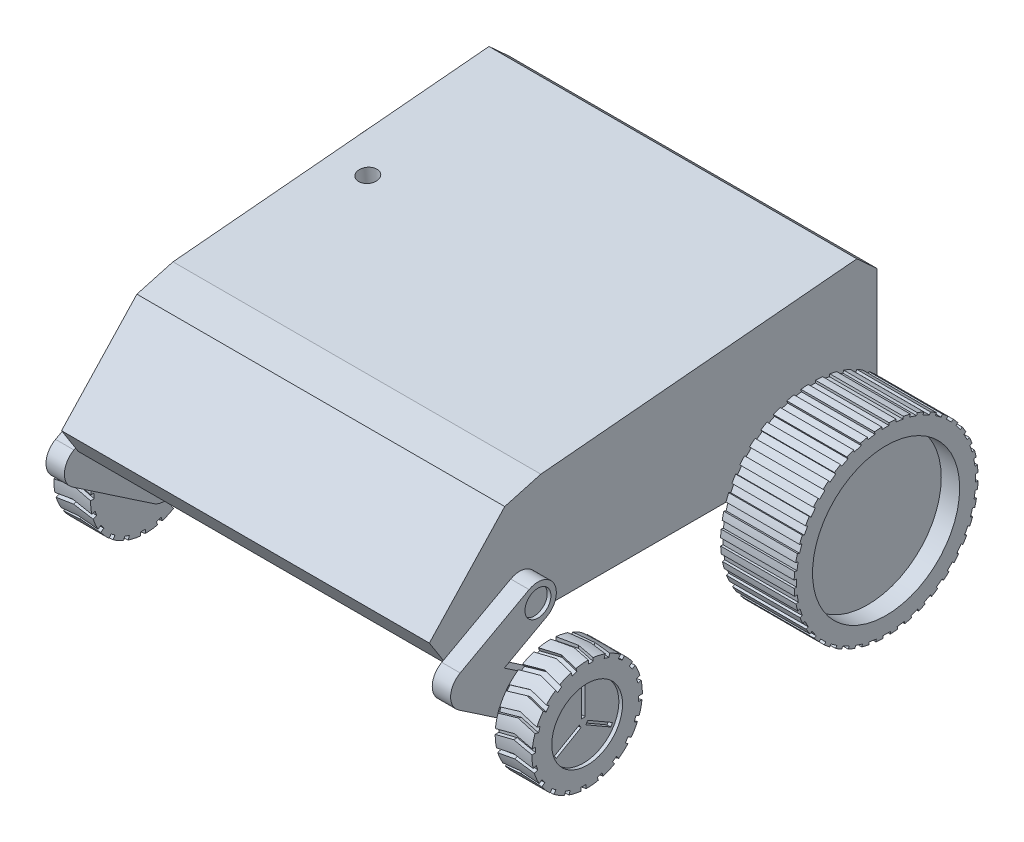
from build123d import *

# Parameters (mm, degrees)
BOSS_EXTRUDE1_DEPTH      = 100
BOSS_EXTRUDE2_DEPTH      = 10
SKETCH4_R                = 7.060387897
CUT_EXTRUDE1_DEPTH       = 2
SKETCH5_R                = 30
BOSS_EXTRUDE3_DEPTH      = 20
SKETCH6_R                = 19.251746144
CUT_EXTRUDE2_DEPTH       = 2
SKETCH7_W                = 1.908440734
SKETCH7_H                = 15.565707942
CUT_EXTRUDE3_DEPTH       = 2
CIRPATTERN1_COUNT        = 3
CUT_EXTRUDE4_DEPTH       = 2
CIRPATTERN2_COUNT        = 20
SKETCH9_R                = 50
BOSS_EXTRUDE4_DEPTH      = 40
SKETCH10_R               = 40
CUT_EXTRUDE6_DEPTH       = 10
SKETCH11_W               = 1.964862178
SKETCH11_H               = 3.929724355
CUT_EXTRUDE7_DEPTH       = 40
CIRPATTERN3_COUNT        = 40
MIRROR1_COPY_1_SKETCH_W  = 1.908440734
MIRROR1_COPY_1_SKETCH_H  = 15.565707942
MIRROR1_COPY_1_DEPTH     = 2
MIRROR1_COPY_2_SKETCH_W  = 1.908440734
MIRROR1_COPY_2_SKETCH_H  = 15.565707942
MIRROR1_COPY_2_DEPTH     = 2
MIRROR1_COPY_3_SKETCH_W  = 1.908440734
MIRROR1_COPY_3_SKETCH_H  = 15.565707942
MIRROR1_COPY_3_DEPTH     = 2
MIRROR1_COPY_4_DEPTH     = 2
MIRROR1_COPY_5_DEPTH     = 2
MIRROR1_COPY_6_DEPTH     = 2
MIRROR1_COPY_7_DEPTH     = 2
MIRROR1_COPY_8_DEPTH     = 2
MIRROR1_COPY_9_DEPTH     = 2
MIRROR1_COPY_10_DEPTH    = 2
MIRROR1_COPY_11_DEPTH    = 2
MIRROR1_COPY_12_DEPTH    = 2
MIRROR1_COPY_13_DEPTH    = 2
MIRROR1_COPY_14_DEPTH    = 2
MIRROR1_COPY_15_DEPTH    = 2
MIRROR1_COPY_16_DEPTH    = 2
MIRROR1_COPY_17_DEPTH    = 2
MIRROR1_COPY_18_DEPTH    = 2
MIRROR1_COPY_19_DEPTH    = 2
MIRROR1_COPY_20_DEPTH    = 2
MIRROR1_COPY_21_DEPTH    = 2
MIRROR1_COPY_22_DEPTH    = 2
MIRROR1_COPY_23_DEPTH    = 2
MIRROR1_COPY_24_SKETCH_W = 1.964862178
MIRROR1_COPY_24_SKETCH_H = 3.929724355
MIRROR1_COPY_24_DEPTH    = 40
MIRROR1_COPY_25_SKETCH_W = 1.964862178
MIRROR1_COPY_25_SKETCH_H = 3.929724355
MIRROR1_COPY_25_DEPTH    = 40
MIRROR1_COPY_26_SKETCH_W = 1.964862178
MIRROR1_COPY_26_SKETCH_H = 3.929724355
MIRROR1_COPY_26_DEPTH    = 40
MIRROR1_COPY_27_SKETCH_W = 1.964862178
MIRROR1_COPY_27_SKETCH_H = 3.929724355
MIRROR1_COPY_27_DEPTH    = 40
MIRROR1_COPY_28_SKETCH_W = 1.964862178
MIRROR1_COPY_28_SKETCH_H = 3.929724355
MIRROR1_COPY_28_DEPTH    = 40
MIRROR1_COPY_29_SKETCH_W = 1.964862178
MIRROR1_COPY_29_SKETCH_H = 3.929724355
MIRROR1_COPY_29_DEPTH    = 40
MIRROR1_COPY_30_SKETCH_W = 1.964862178
MIRROR1_COPY_30_SKETCH_H = 3.929724355
MIRROR1_COPY_30_DEPTH    = 40
MIRROR1_COPY_31_SKETCH_W = 1.964862178
MIRROR1_COPY_31_SKETCH_H = 3.929724355
MIRROR1_COPY_31_DEPTH    = 40
MIRROR1_COPY_32_SKETCH_W = 1.964862178
MIRROR1_COPY_32_SKETCH_H = 3.929724355
MIRROR1_COPY_32_DEPTH    = 40
MIRROR1_COPY_33_SKETCH_W = 1.964862178
MIRROR1_COPY_33_SKETCH_H = 3.929724355
MIRROR1_COPY_33_DEPTH    = 40
MIRROR1_COPY_34_SKETCH_W = 1.964862178
MIRROR1_COPY_34_SKETCH_H = 3.929724355
MIRROR1_COPY_34_DEPTH    = 40
MIRROR1_COPY_35_SKETCH_W = 1.964862178
MIRROR1_COPY_35_SKETCH_H = 3.929724355
MIRROR1_COPY_35_DEPTH    = 40
MIRROR1_COPY_36_SKETCH_W = 1.964862178
MIRROR1_COPY_36_SKETCH_H = 3.929724355
MIRROR1_COPY_36_DEPTH    = 40
MIRROR1_COPY_37_SKETCH_W = 1.964862178
MIRROR1_COPY_37_SKETCH_H = 3.929724355
MIRROR1_COPY_37_DEPTH    = 40
MIRROR1_COPY_38_SKETCH_W = 1.964862178
MIRROR1_COPY_38_SKETCH_H = 3.929724355
MIRROR1_COPY_38_DEPTH    = 40
MIRROR1_COPY_39_SKETCH_W = 1.964862178
MIRROR1_COPY_39_SKETCH_H = 3.929724355
MIRROR1_COPY_39_DEPTH    = 40
MIRROR1_COPY_40_SKETCH_W = 1.964862178
MIRROR1_COPY_40_SKETCH_H = 3.929724355
MIRROR1_COPY_40_DEPTH    = 40
MIRROR1_COPY_41_SKETCH_W = 1.964862178
MIRROR1_COPY_41_SKETCH_H = 3.929724355
MIRROR1_COPY_41_DEPTH    = 40
MIRROR1_COPY_42_SKETCH_W = 1.964862178
MIRROR1_COPY_42_SKETCH_H = 3.929724355
MIRROR1_COPY_42_DEPTH    = 40
MIRROR1_COPY_43_SKETCH_W = 1.964862178
MIRROR1_COPY_43_SKETCH_H = 3.929724355
MIRROR1_COPY_43_DEPTH    = 40
MIRROR1_COPY_44_SKETCH_W = 1.964862178
MIRROR1_COPY_44_SKETCH_H = 3.929724355
MIRROR1_COPY_44_DEPTH    = 40
MIRROR1_COPY_45_SKETCH_W = 1.964862178
MIRROR1_COPY_45_SKETCH_H = 3.929724355
MIRROR1_COPY_45_DEPTH    = 40
MIRROR1_COPY_46_SKETCH_W = 1.964862178
MIRROR1_COPY_46_SKETCH_H = 3.929724355
MIRROR1_COPY_46_DEPTH    = 40
MIRROR1_COPY_47_SKETCH_W = 1.964862178
MIRROR1_COPY_47_SKETCH_H = 3.929724355
MIRROR1_COPY_47_DEPTH    = 40
MIRROR1_COPY_48_SKETCH_W = 1.964862178
MIRROR1_COPY_48_SKETCH_H = 3.929724355
MIRROR1_COPY_48_DEPTH    = 40
MIRROR1_COPY_49_SKETCH_W = 1.964862178
MIRROR1_COPY_49_SKETCH_H = 3.929724355
MIRROR1_COPY_49_DEPTH    = 40
MIRROR1_COPY_50_SKETCH_W = 1.964862178
MIRROR1_COPY_50_SKETCH_H = 3.929724355
MIRROR1_COPY_50_DEPTH    = 40
MIRROR1_COPY_51_SKETCH_W = 1.964862178
MIRROR1_COPY_51_SKETCH_H = 3.929724355
MIRROR1_COPY_51_DEPTH    = 40
MIRROR1_COPY_52_SKETCH_W = 1.964862178
MIRROR1_COPY_52_SKETCH_H = 3.929724355
MIRROR1_COPY_52_DEPTH    = 40
MIRROR1_COPY_53_SKETCH_W = 1.964862178
MIRROR1_COPY_53_SKETCH_H = 3.929724355
MIRROR1_COPY_53_DEPTH    = 40
MIRROR1_COPY_54_SKETCH_W = 1.964862178
MIRROR1_COPY_54_SKETCH_H = 3.929724355
MIRROR1_COPY_54_DEPTH    = 40
MIRROR1_COPY_55_SKETCH_W = 1.964862178
MIRROR1_COPY_55_SKETCH_H = 3.929724355
MIRROR1_COPY_55_DEPTH    = 40
MIRROR1_COPY_56_SKETCH_W = 1.964862178
MIRROR1_COPY_56_SKETCH_H = 3.929724355
MIRROR1_COPY_56_DEPTH    = 40
MIRROR1_COPY_57_SKETCH_W = 1.964862178
MIRROR1_COPY_57_SKETCH_H = 3.929724355
MIRROR1_COPY_57_DEPTH    = 40
MIRROR1_COPY_58_SKETCH_W = 1.964862178
MIRROR1_COPY_58_SKETCH_H = 3.929724355
MIRROR1_COPY_58_DEPTH    = 40
MIRROR1_COPY_59_SKETCH_W = 1.964862178
MIRROR1_COPY_59_SKETCH_H = 3.929724355
MIRROR1_COPY_59_DEPTH    = 40
MIRROR1_COPY_60_SKETCH_W = 1.964862178
MIRROR1_COPY_60_SKETCH_H = 3.929724355
MIRROR1_COPY_60_DEPTH    = 40
MIRROR1_COPY_61_SKETCH_W = 1.964862178
MIRROR1_COPY_61_SKETCH_H = 3.929724355
MIRROR1_COPY_61_DEPTH    = 40
MIRROR1_COPY_62_SKETCH_W = 1.964862178
MIRROR1_COPY_62_SKETCH_H = 3.929724355
MIRROR1_COPY_62_DEPTH    = 40
MIRROR1_COPY_63_SKETCH_W = 1.964862178
MIRROR1_COPY_63_SKETCH_H = 3.929724355
MIRROR1_COPY_63_DEPTH    = 40
SKETCH12_R               = 5
CUT_EXTRUDE8_DEPTH       = 10


with BuildPart() as part:
    # Sketch2 → Boss-Extrude1 (new, symmetric)
    with BuildSketch(Plane(origin=(0, 0, 0), x_dir=(0, 0, -1), z_dir=(1, 0, 0))):
        Polygon((-52.068712601, 63.521766104), (-71.699835093, 58.096578332), (-112.67312909, 14.303868284), (-103.595649647, 0), (120.646817248, 0), (130.646817248, 10), (130.646817248, 69.057563665), (119.748610721, 79.017143226), align=None)
    extrude(amount=BOSS_EXTRUDE1_DEPTH, both=True)

    # Sketch3 → Boss-Extrude2 (add)
    with BuildSketch(Plane(origin=(100, 0, 0), x_dir=(0, 0, -1), z_dir=(1, 0, 0))):
        with BuildLine():
            Line((-106.727157144, -15.2070753), (-62.498185944, -45.147816854))
            ThreePointArc((-62.498185944, -45.147816854), (-48.61138022, -42.472629612), (-51.286567461, -28.585823888))
            Line((-51.286567461, -28.585823888), (-81.94732065, -7.830068957))
            Line((-81.94732065, -7.830068957), (-58.843844634, 4.817340342))
            ThreePointArc((-58.843844634, 4.817340342), (-54.873996715, 18.390855271), (-68.447511643, 22.360703189))
            Line((-68.447511643, 22.360703189), (-105.923181407, 1.845602606))
            ThreePointArc((-105.923181407, 1.845602606), (-111.110252388, -6.45513596), (-106.727157144, -15.2070753))
        make_face()
    boss_extrude2 = extrude(amount=BOSS_EXTRUDE2_DEPTH)

    # Sketch4 → Cut-Extrude1 (cut)
    with BuildSketch(Plane(origin=(110, 0, 0), x_dir=(0, 0, -1), z_dir=(1, 0, 0))):
        with Locations((-63.645678139, 13.589021766)):
            Circle(SKETCH4_R)
    extrude(amount=-CUT_EXTRUDE1_DEPTH, mode=Mode.SUBTRACT)

    # Sketch5 → Boss-Extrude3 (add)
    with BuildSketch(Plane(origin=(110, 0, 0), x_dir=(0, 0, -1), z_dir=(1, 0, 0))):
        with Locations((-56.892376703, -36.866820371)):
            Circle(SKETCH5_R)
    boss_extrude3 = extrude(amount=BOSS_EXTRUDE3_DEPTH)

    # Sketch6 → Cut-Extrude2 (cut)
    with BuildSketch(Plane(origin=(130, 0, 0), x_dir=(0, 0, -1), z_dir=(1, 0, 0))):
        with Locations((-56.892376703, -36.866820371)):
            Circle(SKETCH6_R)
    cut_extrude2 = extrude(amount=-CUT_EXTRUDE2_DEPTH, mode=Mode.SUBTRACT)

    # Sketch7 → Cut-Extrude3 (cut)
    with BuildSketch(Plane(origin=(128, 0, 0), x_dir=(0, 0, -1), z_dir=(1, 0, 0))):
        with Locations((-56.892376703, -26.98617405)):
            Rectangle(SKETCH7_W, SKETCH7_H)
    cut_extrude3 = extrude(amount=-CUT_EXTRUDE3_DEPTH, mode=Mode.SUBTRACT)

    # CirPattern1: Cut-Extrude3 ×3 about axis
    cirpattern1_axis = Axis((128, -36.866820371, 56.892376703), (1, 0, 0))
    for i in range(1, CIRPATTERN1_COUNT):
        add(cut_extrude3.rotate(cirpattern1_axis, i * 360 / CIRPATTERN1_COUNT), mode=Mode.SUBTRACT)

    # Sketch8 → Cut-Extrude4 (cut)
    with BuildSketch(Plane(origin=(0, 0, 26.892376703), x_dir=(-1, 0, 0), z_dir=(0, 0, -1))):
        Polygon((-119.962011175, -39.569901117), (-109.069375128, -36.90013738), (-109.069375128, -39.569901117), (-119.962011175, -42.239664854), (-132.776877113, -39.569901117), (-132.776877113, -36.90013738), align=None)
    cut_extrude4 = extrude(amount=-CUT_EXTRUDE4_DEPTH, mode=Mode.SUBTRACT)

    # CirPattern2: Cut-Extrude4 ×20 about axis
    cirpattern2_axis = Axis((130, -36.866820371, 56.892376703), (1, 0, 0))
    for i in range(1, CIRPATTERN2_COUNT):
        add(cut_extrude4.rotate(cirpattern2_axis, i * 360 / CIRPATTERN2_COUNT), mode=Mode.SUBTRACT)

    # Sketch9 → Boss-Extrude4 (add)
    with BuildSketch(Plane(origin=(100, 0, 0), x_dir=(0, 0, -1), z_dir=(1, 0, 0))):
        with Locations((95.646817248, -16.866820371)):
            Circle(SKETCH9_R)
    boss_extrude4 = extrude(amount=BOSS_EXTRUDE4_DEPTH)

    # Sketch10 → Cut-Extrude6 (cut)
    with BuildSketch(Plane(origin=(140, 0, 0), x_dir=(0, 0, -1), z_dir=(1, 0, 0))):
        with Locations((95.646817248, -16.866820371)):
            Circle(SKETCH10_R)
    cut_extrude6 = extrude(amount=-CUT_EXTRUDE6_DEPTH, mode=Mode.SUBTRACT)

    # Sketch11 → Cut-Extrude7 (cut)
    with BuildSketch(Plane(origin=(140, 0, 0), x_dir=(0, 0, -1), z_dir=(1, 0, 0))):
        with Locations((145.317904313, -16.495970473)):
            Rectangle(SKETCH11_W, SKETCH11_H)
    cut_extrude7 = extrude(amount=-CUT_EXTRUDE7_DEPTH, mode=Mode.SUBTRACT)

    # CirPattern3: Cut-Extrude7 ×40 about axis
    cirpattern3_axis = Axis((140, -16.866820371, -95.646817248), (1, 0, 0))
    for i in range(1, CIRPATTERN3_COUNT):
        add(cut_extrude7.rotate(cirpattern3_axis, i * 360 / CIRPATTERN3_COUNT), mode=Mode.SUBTRACT)

    # Mirror1: Boss-Extrude2, Boss-Extrude3, Cut-Extrude2, Boss-Extrude4, Cut-Extrude6 across plane
    add(boss_extrude2.mirror(Plane(origin=(0, 0, 0), x_dir=(0, 0, 1), z_dir=(1, 0, 0))))
    add(boss_extrude3.mirror(Plane(origin=(0, 0, 0), x_dir=(0, 0, 1), z_dir=(1, 0, 0))))
    add(cut_extrude2.mirror(Plane(origin=(0, 0, 0), x_dir=(0, 0, 1), z_dir=(1, 0, 0))), mode=Mode.SUBTRACT)
    add(boss_extrude4.mirror(Plane(origin=(0, 0, 0), x_dir=(0, 0, 1), z_dir=(1, 0, 0))))
    add(cut_extrude6.mirror(Plane(origin=(0, 0, 0), x_dir=(0, 0, 1), z_dir=(1, 0, 0))), mode=Mode.SUBTRACT)

    # Mirror1 copy 1 sketch → Mirror1 copy 1 (cut)
    with BuildSketch(Plane(origin=(-128, -6.02998705, 117.266168052), x_dir=(0, 0.8660254037844387, 0.4999999999999998), z_dir=(-1, 0, 0))):
        with Locations((-56.892376703, 26.98617405)):
            Rectangle(MIRROR1_COPY_1_SKETCH_W, MIRROR1_COPY_1_SKETCH_H)
    extrude(amount=-MIRROR1_COPY_1_DEPTH, mode=Mode.SUBTRACT)

    # Mirror1 copy 2 sketch → Mirror1 copy 2 (cut)
    with BuildSketch(Plane(origin=(-128, -104.570474062, 53.410962056), x_dir=(0, -0.8660254037844384, 0.5000000000000004), z_dir=(-1, 0, 0))):
        with Locations((-56.892376703, 26.98617405)):
            Rectangle(MIRROR1_COPY_2_SKETCH_W, MIRROR1_COPY_2_SKETCH_H)
    extrude(amount=-MIRROR1_COPY_2_DEPTH, mode=Mode.SUBTRACT)

    # Mirror1 copy 3 sketch → Mirror1 copy 3 (cut)
    with BuildSketch(Plane(origin=(-128, 0, 0), x_dir=(0, 0, -1), z_dir=(-1, 0, 0))):
        with Locations((-56.892376703, 26.98617405)):
            Rectangle(MIRROR1_COPY_3_SKETCH_W, MIRROR1_COPY_3_SKETCH_H)
    extrude(amount=-MIRROR1_COPY_3_DEPTH, mode=Mode.SUBTRACT)

    # Mirror1 copy 4 sketch → Mirror1 copy 4 (cut)
    with BuildSketch(Plane(origin=(0, 7.466119209, 39.753155237), x_dir=(1, 0, 0), z_dir=(0, 0.3090169943749474, -0.9510565162951535))):
        Polygon((-119.962011175, 39.569901117), (-109.069375128, 36.90013738), (-109.069375128, 39.569901117), (-119.962011175, 42.239664854), (-132.776877113, 39.569901117), (-132.776877113, 36.90013738), align=None)
    extrude(amount=-MIRROR1_COPY_4_DEPTH, mode=Mode.SUBTRACT)

    # Mirror1 copy 5 sketch → Mirror1 copy 5 (cut)
    with BuildSketch(Plane(origin=(0, 10.592621407, 54.291640184), x_dir=(1, 0, 0), z_dir=(0, 0.5877852522924731, -0.8090169943749475))):
        Polygon((-119.962011175, 39.569901117), (-109.069375128, 36.90013738), (-109.069375128, 39.569901117), (-119.962011175, 42.239664854), (-132.776877113, 39.569901117), (-132.776877113, 36.90013738), align=None)
    extrude(amount=-MIRROR1_COPY_5_DEPTH, mode=Mode.SUBTRACT)

    # Mirror1 copy 6 sketch → Mirror1 copy 6 (cut)
    with BuildSketch(Plane(origin=(0, 9.073462773, 69.084703343), x_dir=(1, 0, 0), z_dir=(0, 0.8090169943749475, -0.5877852522924731))):
        Polygon((-119.962011175, 39.569901117), (-109.069375128, 36.90013738), (-109.069375128, 39.569901117), (-119.962011175, 42.239664854), (-132.776877113, 39.569901117), (-132.776877113, 36.90013738), align=None)
    extrude(amount=-MIRROR1_COPY_6_DEPTH, mode=Mode.SUBTRACT)

    # Mirror1 copy 7 sketch → Mirror1 copy 7 (cut)
    with BuildSketch(Plane(origin=(0, 3.057349141, 82.68429662), x_dir=(1, 0, 0), z_dir=(0, 0.9510565162951535, -0.30901699437494745))):
        Polygon((-119.962011175, 39.569901117), (-109.069375128, 36.90013738), (-109.069375128, 39.569901117), (-119.962011175, 42.239664854), (-132.776877113, 39.569901117), (-132.776877113, 36.90013738), align=None)
    extrude(amount=-MIRROR1_COPY_7_DEPTH, mode=Mode.SUBTRACT)

    # Mirror1 copy 8 sketch → Mirror1 copy 8 (cut)
    with BuildSketch(Plane(origin=(0, -6.866820371, 93.759197074), x_dir=(1, 0, 0), z_dir=(0, 1, 0))):
        Polygon((-119.962011175, 39.569901117), (-109.069375128, 36.90013738), (-109.069375128, 39.569901117), (-119.962011175, 42.239664854), (-132.776877113, 39.569901117), (-132.776877113, 36.90013738), align=None)
    extrude(amount=-MIRROR1_COPY_8_DEPTH, mode=Mode.SUBTRACT)

    # Mirror1 copy 9 sketch → Mirror1 copy 9 (cut)
    with BuildSketch(Plane(origin=(0, -19.727598905, 101.225316283), x_dir=(1, 0, 0), z_dir=(0, 0.9510565162951536, 0.30901699437494734))):
        Polygon((-119.962011175, 39.569901117), (-109.069375128, 36.90013738), (-109.069375128, 39.569901117), (-119.962011175, 42.239664854), (-132.776877113, 39.569901117), (-132.776877113, 36.90013738), align=None)
    extrude(amount=-MIRROR1_COPY_9_DEPTH, mode=Mode.SUBTRACT)

    # Mirror1 copy 10 sketch → Mirror1 copy 10 (cut)
    with BuildSketch(Plane(origin=(0, -34.266083852, 104.35181848), x_dir=(1, 0, 0), z_dir=(0, 0.8090169943749475, 0.587785252292473))):
        Polygon((-119.962011175, 39.569901117), (-109.069375128, 36.90013738), (-109.069375128, 39.569901117), (-119.962011175, 42.239664854), (-132.776877113, 39.569901117), (-132.776877113, 36.90013738), align=None)
    extrude(amount=-MIRROR1_COPY_10_DEPTH, mode=Mode.SUBTRACT)

    # Mirror1 copy 11 sketch → Mirror1 copy 11 (cut)
    with BuildSketch(Plane(origin=(0, -49.059147011, 102.832659847), x_dir=(1, 0, 0), z_dir=(0, 0.5877852522924732, 0.8090169943749473))):
        Polygon((-119.962011175, 39.569901117), (-109.069375128, 36.90013738), (-109.069375128, 39.569901117), (-119.962011175, 42.239664854), (-132.776877113, 39.569901117), (-132.776877113, 36.90013738), align=None)
    extrude(amount=-MIRROR1_COPY_11_DEPTH, mode=Mode.SUBTRACT)

    # Mirror1 copy 12 sketch → Mirror1 copy 12 (cut)
    with BuildSketch(Plane(origin=(0, -62.658740288, 96.816546215), x_dir=(1, 0, 0), z_dir=(0, 0.3090169943749475, 0.9510565162951535))):
        Polygon((-119.962011175, 39.569901117), (-109.069375128, 36.90013738), (-109.069375128, 39.569901117), (-119.962011175, 42.239664854), (-132.776877113, 39.569901117), (-132.776877113, 36.90013738), align=None)
    extrude(amount=-MIRROR1_COPY_12_DEPTH, mode=Mode.SUBTRACT)

    # Mirror1 copy 13 sketch → Mirror1 copy 13 (cut)
    with BuildSketch(Plane(origin=(0, -73.733640742, 86.892376703), x_dir=(1, 0, 0), z_dir=(0, 0, 1))):
        Polygon((-119.962011175, 39.569901117), (-109.069375128, 36.90013738), (-109.069375128, 39.569901117), (-119.962011175, 42.239664854), (-132.776877113, 39.569901117), (-132.776877113, 36.90013738), align=None)
    extrude(amount=-MIRROR1_COPY_13_DEPTH, mode=Mode.SUBTRACT)

    # Mirror1 copy 14 sketch → Mirror1 copy 14 (cut)
    with BuildSketch(Plane(origin=(0, -81.199759951, 74.031598168), x_dir=(1, 0, 0), z_dir=(0, -0.3090169943749473, 0.9510565162951536))):
        Polygon((-119.962011175, 39.569901117), (-109.069375128, 36.90013738), (-109.069375128, 39.569901117), (-119.962011175, 42.239664854), (-132.776877113, 39.569901117), (-132.776877113, 36.90013738), align=None)
    extrude(amount=-MIRROR1_COPY_14_DEPTH, mode=Mode.SUBTRACT)

    # Mirror1 copy 15 sketch → Mirror1 copy 15 (cut)
    with BuildSketch(Plane(origin=(0, -84.326262148, 59.493113221), x_dir=(1, 0, 0), z_dir=(0, -0.587785252292473, 0.8090169943749476))):
        Polygon((-119.962011175, 39.569901117), (-109.069375128, 36.90013738), (-109.069375128, 39.569901117), (-119.962011175, 42.239664854), (-132.776877113, 39.569901117), (-132.776877113, 36.90013738), align=None)
    extrude(amount=-MIRROR1_COPY_15_DEPTH, mode=Mode.SUBTRACT)

    # Mirror1 copy 16 sketch → Mirror1 copy 16 (cut)
    with BuildSketch(Plane(origin=(0, -82.807103515, 44.700050063), x_dir=(1, 0, 0), z_dir=(0, -0.8090169943749473, 0.5877852522924732))):
        Polygon((-119.962011175, 39.569901117), (-109.069375128, 36.90013738), (-109.069375128, 39.569901117), (-119.962011175, 42.239664854), (-132.776877113, 39.569901117), (-132.776877113, 36.90013738), align=None)
    extrude(amount=-MIRROR1_COPY_16_DEPTH, mode=Mode.SUBTRACT)

    # Mirror1 copy 17 sketch → Mirror1 copy 17 (cut)
    with BuildSketch(Plane(origin=(0, -76.790989883, 31.100456785), x_dir=(1, 0, 0), z_dir=(0, -0.9510565162951535, 0.30901699437494756))):
        Polygon((-119.962011175, 39.569901117), (-109.069375128, 36.90013738), (-109.069375128, 39.569901117), (-119.962011175, 42.239664854), (-132.776877113, 39.569901117), (-132.776877113, 36.90013738), align=None)
    extrude(amount=-MIRROR1_COPY_17_DEPTH, mode=Mode.SUBTRACT)

    # Mirror1 copy 18 sketch → Mirror1 copy 18 (cut)
    with BuildSketch(Plane(origin=(0, -66.866820371, 20.025556332), x_dir=(1, 0, 0), z_dir=(0, -1, 0))):
        Polygon((-119.962011175, 39.569901117), (-109.069375128, 36.90013738), (-109.069375128, 39.569901117), (-119.962011175, 42.239664854), (-132.776877113, 39.569901117), (-132.776877113, 36.90013738), align=None)
    extrude(amount=-MIRROR1_COPY_18_DEPTH, mode=Mode.SUBTRACT)

    # Mirror1 copy 19 sketch → Mirror1 copy 19 (cut)
    with BuildSketch(Plane(origin=(0, -54.006041837, 12.559437123), x_dir=(1, 0, 0), z_dir=(0, -0.9510565162951536, -0.30901699437494723))):
        Polygon((-119.962011175, 39.569901117), (-109.069375128, 36.90013738), (-109.069375128, 39.569901117), (-119.962011175, 42.239664854), (-132.776877113, 39.569901117), (-132.776877113, 36.90013738), align=None)
    extrude(amount=-MIRROR1_COPY_19_DEPTH, mode=Mode.SUBTRACT)

    # Mirror1 copy 20 sketch → Mirror1 copy 20 (cut)
    with BuildSketch(Plane(origin=(0, -39.467556889, 9.432934925), x_dir=(1, 0, 0), z_dir=(0, -0.8090169943749476, -0.5877852522924729))):
        Polygon((-119.962011175, 39.569901117), (-109.069375128, 36.90013738), (-109.069375128, 39.569901117), (-119.962011175, 42.239664854), (-132.776877113, 39.569901117), (-132.776877113, 36.90013738), align=None)
    extrude(amount=-MIRROR1_COPY_20_DEPTH, mode=Mode.SUBTRACT)

    # Mirror1 copy 21 sketch → Mirror1 copy 21 (cut)
    with BuildSketch(Plane(origin=(0, -24.674493731, 10.952093559), x_dir=(1, 0, 0), z_dir=(0, -0.5877852522924734, -0.8090169943749473))):
        Polygon((-119.962011175, 39.569901117), (-109.069375128, 36.90013738), (-109.069375128, 39.569901117), (-119.962011175, 42.239664854), (-132.776877113, 39.569901117), (-132.776877113, 36.90013738), align=None)
    extrude(amount=-MIRROR1_COPY_21_DEPTH, mode=Mode.SUBTRACT)

    # Mirror1 copy 22 sketch → Mirror1 copy 22 (cut)
    with BuildSketch(Plane(origin=(0, -11.074900453, 16.968207191), x_dir=(1, 0, 0), z_dir=(0, -0.3090169943749476, -0.9510565162951535))):
        Polygon((-119.962011175, 39.569901117), (-109.069375128, 36.90013738), (-109.069375128, 39.569901117), (-119.962011175, 42.239664854), (-132.776877113, 39.569901117), (-132.776877113, 36.90013738), align=None)
    extrude(amount=-MIRROR1_COPY_22_DEPTH, mode=Mode.SUBTRACT)

    # Mirror1 copy 23 sketch → Mirror1 copy 23 (cut)
    with BuildSketch(Plane(origin=(0, 0, 26.892376703), x_dir=(1, 0, 0), z_dir=(0, 0, -1))):
        Polygon((-119.962011175, 39.569901117), (-109.069375128, 36.90013738), (-109.069375128, 39.569901117), (-119.962011175, 42.239664854), (-132.776877113, 39.569901117), (-132.776877113, 36.90013738), align=None)
    extrude(amount=-MIRROR1_COPY_23_DEPTH, mode=Mode.SUBTRACT)

    # Mirror1 copy 24 sketch → Mirror1 copy 24 (cut)
    with BuildSketch(Plane(origin=(-140, -15.170117237, 1.460980985), x_dir=(0, 0.15643446504023087, -0.9876883405951378), z_dir=(-1, 0, 0))):
        with Locations((145.317904313, 16.495970473)):
            Rectangle(MIRROR1_COPY_24_SKETCH_W, MIRROR1_COPY_24_SKETCH_H)
    extrude(amount=-MIRROR1_COPY_24_DEPTH, mode=Mode.SUBTRACT)

    # Mirror1 copy 25 sketch → Mirror1 copy 25 (cut)
    with BuildSketch(Plane(origin=(-140, -30.382012936, 0.530845694), x_dir=(0, 0.3090169943749474, -0.9510565162951535), z_dir=(-1, 0, 0))):
        with Locations((145.317904313, 16.495970473)):
            Rectangle(MIRROR1_COPY_25_SKETCH_W, MIRROR1_COPY_25_SKETCH_H)
    extrude(amount=-MIRROR1_COPY_25_DEPTH, mode=Mode.SUBTRACT)

    # Mirror1 copy 26 sketch → Mirror1 copy 26 (cut)
    with BuildSketch(Plane(origin=(-140, -45.261119739, -2.767502853), x_dir=(0, 0.45399049973954675, -0.8910065241883679), z_dir=(-1, 0, 0))):
        with Locations((145.317904313, 16.495970473)):
            Rectangle(MIRROR1_COPY_26_SKETCH_W, MIRROR1_COPY_26_SKETCH_H)
    extrude(amount=-MIRROR1_COPY_26_DEPTH, mode=Mode.SUBTRACT)

    # Mirror1 copy 27 sketch → Mirror1 copy 27 (cut)
    with BuildSketch(Plane(origin=(-140, -59.441064657, -8.35284837), x_dir=(0, 0.5877852522924731, -0.8090169943749475), z_dir=(-1, 0, 0))):
        with Locations((145.317904313, 16.495970473)):
            Rectangle(MIRROR1_COPY_27_SKETCH_W, MIRROR1_COPY_27_SKETCH_H)
    extrude(amount=-MIRROR1_COPY_27_DEPTH, mode=Mode.SUBTRACT)

    # Mirror1 copy 28 sketch → Mirror1 copy 28 (cut)
    with BuildSketch(Plane(origin=(-140, -72.572690385, -16.087661112), x_dir=(0, 0.7071067811865475, -0.7071067811865476), z_dir=(-1, 0, 0))):
        with Locations((145.317904313, 16.495970473)):
            Rectangle(MIRROR1_COPY_28_SKETCH_W, MIRROR1_COPY_28_SKETCH_H)
    extrude(amount=-MIRROR1_COPY_28_DEPTH, mode=Mode.SUBTRACT)

    # Mirror1 copy 29 sketch → Mirror1 copy 29 (cut)
    with BuildSketch(Plane(origin=(-140, -84.332652716, -25.78148432), x_dir=(0, 0.8090169943749475, -0.5877852522924731), z_dir=(-1, 0, 0))):
        with Locations((145.317904313, 16.495970473)):
            Rectangle(MIRROR1_COPY_29_SKETCH_W, MIRROR1_COPY_29_SKETCH_H)
    extrude(amount=-MIRROR1_COPY_29_DEPTH, mode=Mode.SUBTRACT)

    # Mirror1 copy 30 sketch → Mirror1 copy 30 (cut)
    with BuildSketch(Plane(origin=(-140, -94.431382348, -37.195623895), x_dir=(0, 0.8910065241883678, -0.4539904997395468), z_dir=(-1, 0, 0))):
        with Locations((145.317904313, 16.495970473)):
            Rectangle(MIRROR1_COPY_30_SKETCH_W, MIRROR1_COPY_30_SKETCH_H)
    extrude(amount=-MIRROR1_COPY_30_DEPTH, mode=Mode.SUBTRACT)

    # Mirror1 copy 31 sketch → Mirror1 copy 31 (cut)
    with BuildSketch(Plane(origin=(-140, -102.620215042, -50.049025838), x_dir=(0, 0.9510565162951535, -0.30901699437494745), z_dir=(-1, 0, 0))):
        with Locations((145.317904313, 16.495970473)):
            Rectangle(MIRROR1_COPY_31_SKETCH_W, MIRROR1_COPY_31_SKETCH_H)
    extrude(amount=-MIRROR1_COPY_31_DEPTH, mode=Mode.SUBTRACT)

    # Mirror1 copy 32 sketch → Mirror1 copy 32 (cut)
    with BuildSketch(Plane(origin=(-140, -108.697514561, -64.025196736), x_dir=(0, 0.9876883405951378, -0.15643446504023092), z_dir=(-1, 0, 0))):
        with Locations((145.317904313, 16.495970473)):
            Rectangle(MIRROR1_COPY_32_SKETCH_W, MIRROR1_COPY_32_SKETCH_H)
    extrude(amount=-MIRROR1_COPY_32_DEPTH, mode=Mode.SUBTRACT)

    # Mirror1 copy 33 sketch → Mirror1 copy 33 (cut)
    with BuildSketch(Plane(origin=(-140, -112.513637619, -78.779996878), x_dir=(0, 1, 0), z_dir=(-1, 0, 0))):
        with Locations((145.317904313, 16.495970473)):
            Rectangle(MIRROR1_COPY_33_SKETCH_W, MIRROR1_COPY_33_SKETCH_H)
    extrude(amount=-MIRROR1_COPY_33_DEPTH, mode=Mode.SUBTRACT)

    # Mirror1 copy 34 sketch → Mirror1 copy 34 (cut)
    with BuildSketch(Plane(origin=(-140, -113.974618604, -93.950114114), x_dir=(0, 0.9876883405951378, 0.1564344650402308), z_dir=(-1, 0, 0))):
        with Locations((145.317904313, 16.495970473)):
            Rectangle(MIRROR1_COPY_34_SKETCH_W, MIRROR1_COPY_34_SKETCH_H)
    extrude(amount=-MIRROR1_COPY_34_DEPTH, mode=Mode.SUBTRACT)

    # Mirror1 copy 35 sketch → Mirror1 copy 35 (cut)
    with BuildSketch(Plane(origin=(-140, -113.044483314, -109.162009813), x_dir=(0, 0.9510565162951536, 0.30901699437494734), z_dir=(-1, 0, 0))):
        with Locations((145.317904313, 16.495970473)):
            Rectangle(MIRROR1_COPY_35_SKETCH_W, MIRROR1_COPY_35_SKETCH_H)
    extrude(amount=-MIRROR1_COPY_35_DEPTH, mode=Mode.SUBTRACT)

    # Mirror1 copy 36 sketch → Mirror1 copy 36 (cut)
    with BuildSketch(Plane(origin=(-140, -109.746134766, -124.041116617), x_dir=(0, 0.8910065241883679, 0.4539904997395467), z_dir=(-1, 0, 0))):
        with Locations((145.317904313, 16.495970473)):
            Rectangle(MIRROR1_COPY_36_SKETCH_W, MIRROR1_COPY_36_SKETCH_H)
    extrude(amount=-MIRROR1_COPY_36_DEPTH, mode=Mode.SUBTRACT)

    # Mirror1 copy 37 sketch → Mirror1 copy 37 (cut)
    with BuildSketch(Plane(origin=(-140, -104.16078925, -138.221061535), x_dir=(0, 0.8090169943749475, 0.587785252292473), z_dir=(-1, 0, 0))):
        with Locations((145.317904313, 16.495970473)):
            Rectangle(MIRROR1_COPY_37_SKETCH_W, MIRROR1_COPY_37_SKETCH_H)
    extrude(amount=-MIRROR1_COPY_37_DEPTH, mode=Mode.SUBTRACT)

    # Mirror1 copy 38 sketch → Mirror1 copy 38 (cut)
    with BuildSketch(Plane(origin=(-140, -96.425976507, -151.352687262), x_dir=(0, 0.7071067811865476, 0.7071067811865475), z_dir=(-1, 0, 0))):
        with Locations((145.317904313, 16.495970473)):
            Rectangle(MIRROR1_COPY_38_SKETCH_W, MIRROR1_COPY_38_SKETCH_H)
    extrude(amount=-MIRROR1_COPY_38_DEPTH, mode=Mode.SUBTRACT)

    # Mirror1 copy 39 sketch → Mirror1 copy 39 (cut)
    with BuildSketch(Plane(origin=(-140, -86.732153299, -163.112649593), x_dir=(0, 0.5877852522924732, 0.8090169943749473), z_dir=(-1, 0, 0))):
        with Locations((145.317904313, 16.495970473)):
            Rectangle(MIRROR1_COPY_39_SKETCH_W, MIRROR1_COPY_39_SKETCH_H)
    extrude(amount=-MIRROR1_COPY_39_DEPTH, mode=Mode.SUBTRACT)

    # Mirror1 copy 40 sketch → Mirror1 copy 40 (cut)
    with BuildSketch(Plane(origin=(-140, -75.318013725, -173.211379226), x_dir=(0, 0.45399049973954686, 0.8910065241883678), z_dir=(-1, 0, 0))):
        with Locations((145.317904313, 16.495970473)):
            Rectangle(MIRROR1_COPY_40_SKETCH_W, MIRROR1_COPY_40_SKETCH_H)
    extrude(amount=-MIRROR1_COPY_40_DEPTH, mode=Mode.SUBTRACT)

    # Mirror1 copy 41 sketch → Mirror1 copy 41 (cut)
    with BuildSketch(Plane(origin=(-140, -62.464611781, -181.40021192), x_dir=(0, 0.3090169943749475, 0.9510565162951535), z_dir=(-1, 0, 0))):
        with Locations((145.317904313, 16.495970473)):
            Rectangle(MIRROR1_COPY_41_SKETCH_W, MIRROR1_COPY_41_SKETCH_H)
    extrude(amount=-MIRROR1_COPY_41_DEPTH, mode=Mode.SUBTRACT)

    # Mirror1 copy 42 sketch → Mirror1 copy 42 (cut)
    with BuildSketch(Plane(origin=(-140, -48.488440883, -187.477511438), x_dir=(0, 0.15643446504023098, 0.9876883405951377), z_dir=(-1, 0, 0))):
        with Locations((145.317904313, 16.495970473)):
            Rectangle(MIRROR1_COPY_42_SKETCH_W, MIRROR1_COPY_42_SKETCH_H)
    extrude(amount=-MIRROR1_COPY_42_DEPTH, mode=Mode.SUBTRACT)

    # Mirror1 copy 43 sketch → Mirror1 copy 43 (cut)
    with BuildSketch(Plane(origin=(-140, -33.733640742, -191.293634497), x_dir=(0, 0, 1), z_dir=(-1, 0, 0))):
        with Locations((145.317904313, 16.495970473)):
            Rectangle(MIRROR1_COPY_43_SKETCH_W, MIRROR1_COPY_43_SKETCH_H)
    extrude(amount=-MIRROR1_COPY_43_DEPTH, mode=Mode.SUBTRACT)

    # Mirror1 copy 44 sketch → Mirror1 copy 44 (cut)
    with BuildSketch(Plane(origin=(-140, -18.563523505, -192.754615481), x_dir=(0, -0.15643446504023073, 0.9876883405951378), z_dir=(-1, 0, 0))):
        with Locations((145.317904313, 16.495970473)):
            Rectangle(MIRROR1_COPY_44_SKETCH_W, MIRROR1_COPY_44_SKETCH_H)
    extrude(amount=-MIRROR1_COPY_44_DEPTH, mode=Mode.SUBTRACT)

    # Mirror1 copy 45 sketch → Mirror1 copy 45 (cut)
    with BuildSketch(Plane(origin=(-140, -3.351627806, -191.824480191), x_dir=(0, -0.3090169943749473, 0.9510565162951536), z_dir=(-1, 0, 0))):
        with Locations((145.317904313, 16.495970473)):
            Rectangle(MIRROR1_COPY_45_SKETCH_W, MIRROR1_COPY_45_SKETCH_H)
    extrude(amount=-MIRROR1_COPY_45_DEPTH, mode=Mode.SUBTRACT)

    # Mirror1 copy 46 sketch → Mirror1 copy 46 (cut)
    with BuildSketch(Plane(origin=(-140, 11.527478998, -188.526131644), x_dir=(0, -0.4539904997395467, 0.8910065241883679), z_dir=(-1, 0, 0))):
        with Locations((145.317904313, 16.495970473)):
            Rectangle(MIRROR1_COPY_46_SKETCH_W, MIRROR1_COPY_46_SKETCH_H)
    extrude(amount=-MIRROR1_COPY_46_DEPTH, mode=Mode.SUBTRACT)

    # Mirror1 copy 47 sketch → Mirror1 copy 47 (cut)
    with BuildSketch(Plane(origin=(-140, 25.707423915, -182.940786127), x_dir=(0, -0.587785252292473, 0.8090169943749476), z_dir=(-1, 0, 0))):
        with Locations((145.317904313, 16.495970473)):
            Rectangle(MIRROR1_COPY_47_SKETCH_W, MIRROR1_COPY_47_SKETCH_H)
    extrude(amount=-MIRROR1_COPY_47_DEPTH, mode=Mode.SUBTRACT)

    # Mirror1 copy 48 sketch → Mirror1 copy 48 (cut)
    with BuildSketch(Plane(origin=(-140, 38.839049643, -175.205973385), x_dir=(0, -0.7071067811865475, 0.7071067811865477), z_dir=(-1, 0, 0))):
        with Locations((145.317904313, 16.495970473)):
            Rectangle(MIRROR1_COPY_48_SKETCH_W, MIRROR1_COPY_48_SKETCH_H)
    extrude(amount=-MIRROR1_COPY_48_DEPTH, mode=Mode.SUBTRACT)

    # Mirror1 copy 49 sketch → Mirror1 copy 49 (cut)
    with BuildSketch(Plane(origin=(-140, 50.599011974, -165.512150177), x_dir=(0, -0.8090169943749473, 0.5877852522924732), z_dir=(-1, 0, 0))):
        with Locations((145.317904313, 16.495970473)):
            Rectangle(MIRROR1_COPY_49_SKETCH_W, MIRROR1_COPY_49_SKETCH_H)
    extrude(amount=-MIRROR1_COPY_49_DEPTH, mode=Mode.SUBTRACT)

    # Mirror1 copy 50 sketch → Mirror1 copy 50 (cut)
    with BuildSketch(Plane(origin=(-140, 60.697741606, -154.098010602), x_dir=(0, -0.8910065241883678, 0.4539904997395469), z_dir=(-1, 0, 0))):
        with Locations((145.317904313, 16.495970473)):
            Rectangle(MIRROR1_COPY_50_SKETCH_W, MIRROR1_COPY_50_SKETCH_H)
    extrude(amount=-MIRROR1_COPY_50_DEPTH, mode=Mode.SUBTRACT)

    # Mirror1 copy 51 sketch → Mirror1 copy 51 (cut)
    with BuildSketch(Plane(origin=(-140, 68.886574301, -141.244608659), x_dir=(0, -0.9510565162951535, 0.30901699437494756), z_dir=(-1, 0, 0))):
        with Locations((145.317904313, 16.495970473)):
            Rectangle(MIRROR1_COPY_51_SKETCH_W, MIRROR1_COPY_51_SKETCH_H)
    extrude(amount=-MIRROR1_COPY_51_DEPTH, mode=Mode.SUBTRACT)

    # Mirror1 copy 52 sketch → Mirror1 copy 52 (cut)
    with BuildSketch(Plane(origin=(-140, 74.963873819, -127.268437761), x_dir=(0, -0.9876883405951377, 0.15643446504023104), z_dir=(-1, 0, 0))):
        with Locations((145.317904313, 16.495970473)):
            Rectangle(MIRROR1_COPY_52_SKETCH_W, MIRROR1_COPY_52_SKETCH_H)
    extrude(amount=-MIRROR1_COPY_52_DEPTH, mode=Mode.SUBTRACT)

    # Mirror1 copy 53 sketch → Mirror1 copy 53 (cut)
    with BuildSketch(Plane(origin=(-140, 78.779996878, -112.513637619), x_dir=(0, -1, 0), z_dir=(-1, 0, 0))):
        with Locations((145.317904313, 16.495970473)):
            Rectangle(MIRROR1_COPY_53_SKETCH_W, MIRROR1_COPY_53_SKETCH_H)
    extrude(amount=-MIRROR1_COPY_53_DEPTH, mode=Mode.SUBTRACT)

    # Mirror1 copy 54 sketch → Mirror1 copy 54 (cut)
    with BuildSketch(Plane(origin=(-140, 80.240977862, -97.343520383), x_dir=(0, -0.9876883405951378, -0.15643446504023067), z_dir=(-1, 0, 0))):
        with Locations((145.317904313, 16.495970473)):
            Rectangle(MIRROR1_COPY_54_SKETCH_W, MIRROR1_COPY_54_SKETCH_H)
    extrude(amount=-MIRROR1_COPY_54_DEPTH, mode=Mode.SUBTRACT)

    # Mirror1 copy 55 sketch → Mirror1 copy 55 (cut)
    with BuildSketch(Plane(origin=(-140, 79.310842572, -82.131624684), x_dir=(0, -0.9510565162951536, -0.30901699437494723), z_dir=(-1, 0, 0))):
        with Locations((145.317904313, 16.495970473)):
            Rectangle(MIRROR1_COPY_55_SKETCH_W, MIRROR1_COPY_55_SKETCH_H)
    extrude(amount=-MIRROR1_COPY_55_DEPTH, mode=Mode.SUBTRACT)

    # Mirror1 copy 56 sketch → Mirror1 copy 56 (cut)
    with BuildSketch(Plane(origin=(-140, 76.012494025, -67.25251788), x_dir=(0, -0.891006524188368, -0.45399049973954664), z_dir=(-1, 0, 0))):
        with Locations((145.317904313, 16.495970473)):
            Rectangle(MIRROR1_COPY_56_SKETCH_W, MIRROR1_COPY_56_SKETCH_H)
    extrude(amount=-MIRROR1_COPY_56_DEPTH, mode=Mode.SUBTRACT)

    # Mirror1 copy 57 sketch → Mirror1 copy 57 (cut)
    with BuildSketch(Plane(origin=(-140, 70.427148508, -53.072572962), x_dir=(0, -0.8090169943749476, -0.5877852522924729), z_dir=(-1, 0, 0))):
        with Locations((145.317904313, 16.495970473)):
            Rectangle(MIRROR1_COPY_57_SKETCH_W, MIRROR1_COPY_57_SKETCH_H)
    extrude(amount=-MIRROR1_COPY_57_DEPTH, mode=Mode.SUBTRACT)

    # Mirror1 copy 58 sketch → Mirror1 copy 58 (cut)
    with BuildSketch(Plane(origin=(-140, 62.692335766, -39.940947234), x_dir=(0, -0.7071067811865477, -0.7071067811865474), z_dir=(-1, 0, 0))):
        with Locations((145.317904313, 16.495970473)):
            Rectangle(MIRROR1_COPY_58_SKETCH_W, MIRROR1_COPY_58_SKETCH_H)
    extrude(amount=-MIRROR1_COPY_58_DEPTH, mode=Mode.SUBTRACT)

    # Mirror1 copy 59 sketch → Mirror1 copy 59 (cut)
    with BuildSketch(Plane(origin=(-140, 52.998512558, -28.180984904), x_dir=(0, -0.5877852522924734, -0.8090169943749473), z_dir=(-1, 0, 0))):
        with Locations((145.317904313, 16.495970473)):
            Rectangle(MIRROR1_COPY_59_SKETCH_W, MIRROR1_COPY_59_SKETCH_H)
    extrude(amount=-MIRROR1_COPY_59_DEPTH, mode=Mode.SUBTRACT)

    # Mirror1 copy 60 sketch → Mirror1 copy 60 (cut)
    with BuildSketch(Plane(origin=(-140, 41.584372983, -18.082255271), x_dir=(0, -0.45399049973954697, -0.8910065241883678), z_dir=(-1, 0, 0))):
        with Locations((145.317904313, 16.495970473)):
            Rectangle(MIRROR1_COPY_60_SKETCH_W, MIRROR1_COPY_60_SKETCH_H)
    extrude(amount=-MIRROR1_COPY_60_DEPTH, mode=Mode.SUBTRACT)

    # Mirror1 copy 61 sketch → Mirror1 copy 61 (cut)
    with BuildSketch(Plane(origin=(-140, 28.73097104, -9.893422577), x_dir=(0, -0.3090169943749476, -0.9510565162951535), z_dir=(-1, 0, 0))):
        with Locations((145.317904313, 16.495970473)):
            Rectangle(MIRROR1_COPY_61_SKETCH_W, MIRROR1_COPY_61_SKETCH_H)
    extrude(amount=-MIRROR1_COPY_61_DEPTH, mode=Mode.SUBTRACT)

    # Mirror1 copy 62 sketch → Mirror1 copy 62 (cut)
    with BuildSketch(Plane(origin=(-140, 14.754800141, -3.816123059), x_dir=(0, -0.15643446504023112, -0.9876883405951377), z_dir=(-1, 0, 0))):
        with Locations((145.317904313, 16.495970473)):
            Rectangle(MIRROR1_COPY_62_SKETCH_W, MIRROR1_COPY_62_SKETCH_H)
    extrude(amount=-MIRROR1_COPY_62_DEPTH, mode=Mode.SUBTRACT)

    # Mirror1 copy 63 sketch → Mirror1 copy 63 (cut)
    with BuildSketch(Plane(origin=(-140, 0, 0), x_dir=(0, 0, -1), z_dir=(-1, 0, 0))):
        with Locations((145.317904313, 16.495970473)):
            Rectangle(MIRROR1_COPY_63_SKETCH_W, MIRROR1_COPY_63_SKETCH_H)
    extrude(amount=-MIRROR1_COPY_63_DEPTH, mode=Mode.SUBTRACT)

    # Sketch12 → Cut-Extrude8 (cut)
    with BuildSketch(Plane(origin=(0, 67.667230134, 6.102581681), x_dir=(1, 0, 0), z_dir=(0, 0.9959579561140942, 0.0898206527088078))):
        with Locations((-80, 40.104635437)):
            Circle(SKETCH12_R)
    extrude(amount=-CUT_EXTRUDE8_DEPTH, mode=Mode.SUBTRACT)


solid = part.part
